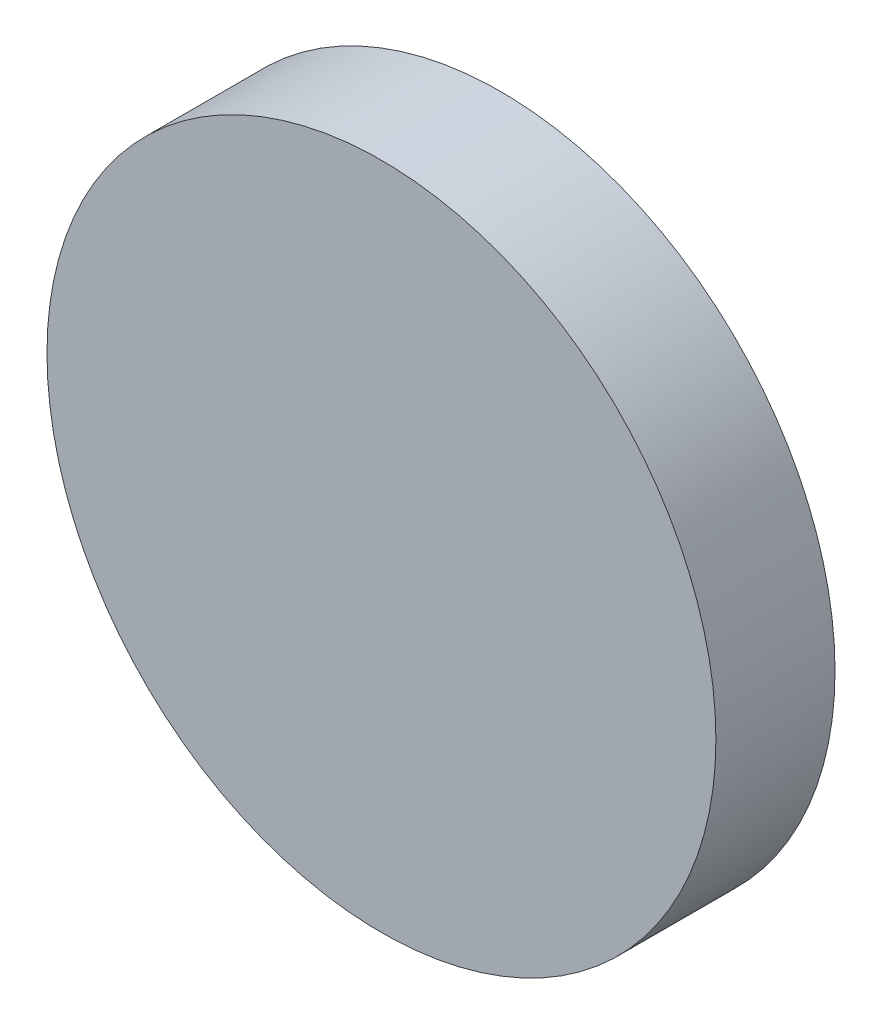
from build123d import *

# Parameters (mm, degrees)
SKETCH1_R           = 46.355
BOSS_EXTRUDE1_DEPTH = 3.81
BOSS_EXTRUDE2_START = 12.7
SKETCH4_R           = 46.355
SKETCH4_R_2         = 44.45
BOSS_EXTRUDE2_DEPTH = 12.7


with BuildPart() as part:
    # Sketch1 → Boss-Extrude1 (new body)
    with BuildSketch(Plane.XY):
        Circle(SKETCH1_R)
    extrude(amount=BOSS_EXTRUDE1_DEPTH)

    # Sketch4 → Boss-Extrude2 (add)
    with BuildSketch(Plane(origin=(0, 0, 0), x_dir=(-1, 0, 0), z_dir=(0, 0, -1)).offset(BOSS_EXTRUDE2_START)):
        Circle(SKETCH4_R)
        Circle(SKETCH4_R_2, mode=Mode.SUBTRACT)
    extrude(amount=-BOSS_EXTRUDE2_DEPTH)


solid = part.part
